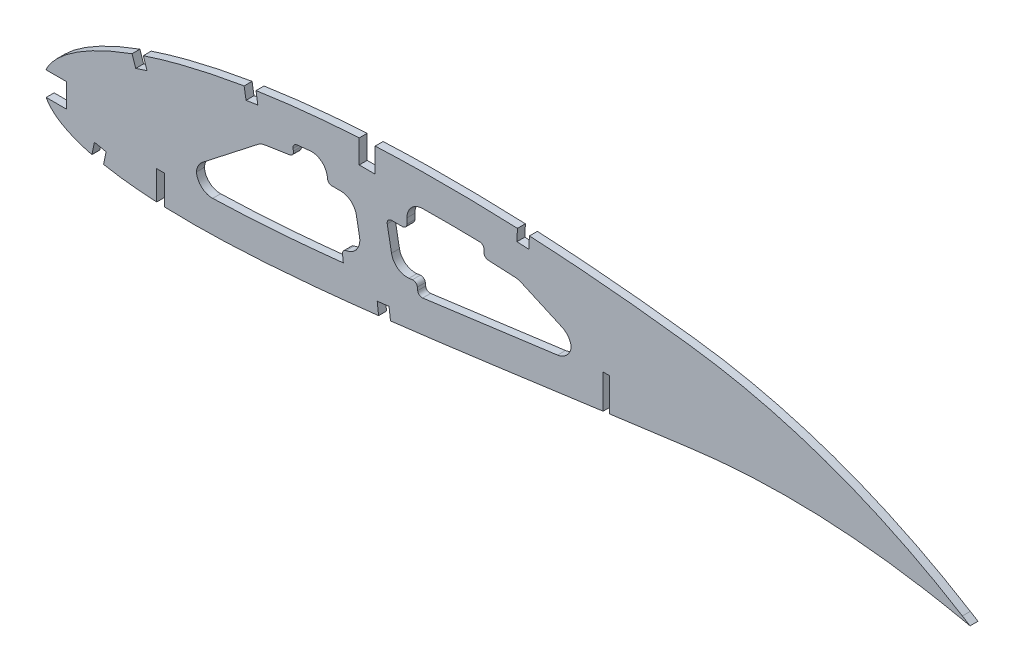
from build123d import *

# Parameters (mm, degrees)
BOSS_EXTRUDE1_DEPTH = 3.175
CUT_EXTRUDE1_DEPTH  = 7.62
SKETCH3_W           = 9.525
SKETCH3_H           = 9.525
CUT_EXTRUDE2_DEPTH  = 7.62
CUT_EXTRUDE3_DEPTH  = 7.62
FILLET1_R           = 6.35
FILLET2_R           = 1.778


with BuildPart() as part:
    # Sketch1 → Boss-Extrude1 (new body)
    with BuildSketch(Plane.XY):
        with BuildLine():
            Line((366.779221984, -0.572532859), (370.310025602, -1.32569148))
            Line((370.310025602, -1.32569148), (367.237248504, 0.572532859))
            add(Edge.make_bspline(
                [(367.237248504, 0.572532859), (367.209115751, 0.589912016), (367.096693954, 0.659361177), (366.843387397, 0.814735964), (366.421579402, 1.073520617), (365.831084917, 1.43391727), (365.072362673, 1.894969327), (364.145030833, 2.453448145), (363.049668235, 3.107539147), (361.78654025, 3.854149183), (360.355776171, 4.689782048), (358.757920825, 5.61105264), (356.993113179, 6.61274511), (355.06203687, 7.690766613), (352.96535437, 8.839989942), (350.703462511, 10.055224806), (348.277171256, 11.330289826), (345.687411743, 12.659700467), (342.934656313, 14.036115757), (340.020202795, 15.453807339), (336.945022097, 16.905706333), (333.710163942, 18.384066929), (330.317486658, 19.882862373), (326.767928213, 21.392774778), (323.06351151, 22.907262237), (319.205813659, 24.417705773), (315.197118609, 25.917225993), (311.038972972, 27.396108947), (306.73448515, 28.847891701), (302.285743308, 30.263143128), (297.695928748, 31.634176974), (292.967708233, 32.952104115), (288.10502333, 34.210165552), (283.11095799, 35.399199558), (277.989744959, 36.511247133), (272.745455003, 37.539613083), (267.382486443, 38.474030655), (261.915700498, 39.313771303), (256.433056518, 40.012293244), (250.961692668, 40.697383276), (245.498477017, 41.34096267), (239.968489428, 41.957278945), (234.377050063, 42.54286215), (228.729705217, 43.095881158), (223.032171983, 43.613949148), (217.290371144, 44.095546934), (211.509858724, 44.537945534), (205.696729956, 44.940463429), (199.8567319, 45.299561873), (193.996084852, 45.614971395), (188.120738144, 45.884492116), (182.236806039, 46.106266996), (176.350536437, 46.278957311), (170.468039484, 46.400908527), (164.595684421, 46.47135392), (158.739579431, 46.488368695), (152.90609078, 46.451648421), (147.101327081, 46.35993231), (141.331661108, 46.21196474), (135.603209819, 46.00746964), (129.92216764, 45.746535631), (124.294754737, 45.426977601), (118.727075839, 45.050831997), (113.22533102, 44.616518763), (107.79556513, 44.123922344), (102.443468619, 43.575096068), (97.175000212, 42.968547242), (91.995806101, 42.306001647), (86.911551284, 41.588758347), (81.927940427, 40.816426555), (77.050312099, 39.991237197), (72.283930644, 39.114034533), (67.633838897, 38.187390229), (63.105099551, 37.211546097), (58.702506527, 36.189429331), (54.430635268, 35.12282073), (50.29407794, 34.013672938), (46.297027813, 32.864647422), (42.443526778, 31.678350961), (38.73806709, 30.456087063), (35.183449271, 29.20248999), (31.784039791, 27.918449689), (28.542442713, 26.607921896), (25.46245696, 25.272695966), (22.546383362, 23.916842473), (19.79752229, 22.541904914), (17.217832841, 21.151735431), (14.809904809, 19.748465709), (12.576056134, 18.334702116), (10.517225629, 16.914030851), (8.636251908, 15.487343527), (6.933781057, 14.058245411), (5.410890546, 12.628912534), (4.069757076, 11.200329631), (2.910332492, 9.775012337), (1.93413617, 8.354089532), (1.141337537, 6.938905699), (0.533729736, 5.530488873), (0.110710257, 4.129631103), (-0.120847754, 2.738400014), (-0.178483964, 1.355680289), (-0.059405759, 0.451218221), (0, 0)],
                knots=[0, 0, 0, 0, 0.00025409, 0.001015374, 0.002283359, 0.004056577, 0.006330982, 0.009105274, 0.01237449, 0.016134024, 0.020379661, 0.025105976, 0.030306237, 0.035972206, 0.042099523, 0.048678064, 0.055701664, 0.063160184, 0.071045824, 0.079349827, 0.08806291, 0.097175757, 0.106678112, 0.116561573, 0.126814276, 0.1374283, 0.148393618, 0.15969976, 0.171338126, 0.183297699, 0.195569604, 0.208143556, 0.221011594, 0.234161831, 0.247587451, 0.261276823, 0.27522271, 0.289414144, 0.3037712, 0.317689227, 0.331784111, 0.346039677, 0.36044387, 0.374982721, 0.389640455, 0.404403317, 0.419256601, 0.43418675, 0.449177265, 0.464214782, 0.479284009, 0.49436974, 0.509457833, 0.524532346, 0.53957932, 0.554582984, 0.569529546, 0.584403417, 0.599190992, 0.613876838, 0.628447475, 0.642888675, 0.657186054, 0.671325546, 0.685294014, 0.699078148, 0.712665095, 0.726042645, 0.739197713, 0.752117587, 0.764792042, 0.777208152, 0.789355685, 0.80122396, 0.812803686, 0.824082909, 0.835054602, 0.845709571, 0.856037853, 0.866033835, 0.875688843, 0.884997719, 0.893953426, 0.902552897, 0.910789386, 0.918660734, 0.926166253, 0.933302626, 0.94007122, 0.94647478, 0.952517526, 0.958204819, 0.963546652, 0.9685566, 0.973249913, 0.977651041, 0.981787043, 0.985694226, 0.989415109, 0.993001157, 0.996508416, 1, 1, 1, 1], degree=3))
            add(Edge.make_bspline(
                [(0, 0), (0.094305225, -0.445183561), (0.283349084, -1.337596664), (0.796956591, -2.622301778), (1.476177967, -3.857275533), (2.335268581, -5.03923752), (3.368516216, -6.167864763), (4.573638936, -7.244331071), (5.949454767, -8.268057766), (7.494163107, -9.238578843), (9.205519965, -10.156924625), (11.08160183, -11.022524069), (13.120698043, -11.835106765), (15.320587008, -12.593586411), (17.678579271, -13.299118217), (20.19243298, -13.949982821), (22.859289626, -14.547089925), (25.676584203, -15.088915361), (28.641246729, -15.576009603), (31.750197347, -16.008099996), (35.00024492, -16.385456897), (38.388200927, -16.707288362), (41.910714326, -16.9742867), (45.564274184, -17.18662904), (49.34533406, -17.344988676), (53.250272092, -17.448763617), (57.275263844, -17.499571714), (61.416671846, -17.498175704), (65.670444823, -17.444202264), (70.032949035, -17.340633073), (74.49999818, -17.186812008), (79.067559409, -16.984600621), (83.731512725, -16.736033793), (88.487675073, -16.441954217), (93.331860865, -16.103665214), (98.259864016, -15.723879754), (103.267207887, -15.30354505), (108.349525408, -14.845111196), (113.502317177, -14.350873178), (118.721131264, -13.822395178), (124.001361141, -13.262163166), (129.338303799, -12.671992621), (134.727419145, -12.055032062), (140.163784234, -11.412397718), (145.642802026, -10.74775877), (151.159318159, -10.062385108), (156.708719705, -9.358916499), (162.286015513, -8.640665313), (167.885984275, -7.907549552), (173.503916032, -7.164792444), (179.134393031, -6.4117822), (184.772514322, -5.652391584), (190.413060751, -4.888980999), (196.050538376, -4.121785421), (201.679991678, -3.353984297), (207.296198332, -2.587685341), (212.893657193, -1.822958656), (218.467304002, -1.063605171), (224.011526297, -0.309532116), (229.521211727, 0.437731721), (234.99108049, 1.175955737), (240.415971972, 1.904208342), (245.79029012, 2.622028682), (251.108627927, 3.329686337), (256.286014622, 4.005702206), (261.308921574, 4.686074193), (266.194275064, 5.243828548), (271.018799677, 5.719891856), (275.78750695, 6.110198164), (280.494670713, 6.420362635), (285.134897569, 6.652601616), (289.702657326, 6.810157431), (294.192180199, 6.897704202), (298.597858723, 6.917463603), (302.913679308, 6.875737092), (307.134028762, 6.775888132), (311.253016964, 6.622398487), (315.264897433, 6.420446666), (319.163971775, 6.175537915), (322.944386272, 5.891284948), (326.600873145, 5.574323732), (330.127790902, 5.229294225), (333.519723856, 4.860138451), (336.771722702, 4.474591735), (339.878582354, 4.075192399), (342.835629531, 3.668504141), (345.638104292, 3.258648226), (348.281568103, 2.850857356), (350.76186785, 2.449021765), (353.074996968, 2.058474907), (355.217332046, 1.682865683), (357.185155535, 1.3258622), (358.975737519, 0.991968888), (360.585541683, 0.682844304), (362.012414965, 0.403582965), (363.253704214, 0.155417071), (364.307589717, -0.058157081), (365.172231074, -0.236296472), (365.846315097, -0.376076876), (366.328510303, -0.477721618), (366.618295084, -0.538205409), (366.747050131, -0.565670254), (366.779221984, -0.572532859)],
                knots=[0, 0, 0, 0, 0.003638255, 0.007293231, 0.011028136, 0.014901081, 0.018963272, 0.023258475, 0.027820626, 0.032679082, 0.03785316, 0.043361875, 0.049214679, 0.055422346, 0.061988786, 0.068918036, 0.076211157, 0.083868392, 0.091887411, 0.100265912, 0.108999867, 0.11808453, 0.127514843, 0.13728527, 0.147387918, 0.157816481, 0.168563473, 0.179619128, 0.190977373, 0.202626974, 0.214560478, 0.226767249, 0.239236417, 0.251959004, 0.264923895, 0.278119703, 0.291536035, 0.30516028, 0.318980685, 0.332985499, 0.347162791, 0.361498603, 0.375980747, 0.390597192, 0.405332594, 0.420174823, 0.435109533, 0.450124276, 0.465203068, 0.480333154, 0.495500583, 0.510689775, 0.525887335, 0.541078314, 0.556247233, 0.571381785, 0.586466041, 0.601484516, 0.616424329, 0.631269423, 0.646006524, 0.660620684, 0.675098187, 0.689422858, 0.703581825, 0.716907564, 0.730009274, 0.742952128, 0.755725558, 0.768319952, 0.780724338, 0.792926529, 0.804916041, 0.816679084, 0.828203524, 0.839474901, 0.850481359, 0.861207697, 0.871639326, 0.881763414, 0.891563605, 0.901027365, 0.910138977, 0.918883977, 0.927249278, 0.935221104, 0.942784739, 0.949928188, 0.956638465, 0.962904204, 0.968712288, 0.974054485, 0.978918432, 0.983297218, 0.987180246, 0.990560675, 0.993433358, 0.995790626, 0.997629588, 0.998945816, 0.999736593, 1, 1, 1, 1], degree=3))
        make_face()
    extrude(amount=BOSS_EXTRUDE1_DEPTH)

    # Sketch2 → Cut-Extrude1 (cut)
    with BuildSketch(Plane(origin=(0, 0, 0), x_dir=(-1, 0, 0), z_dir=(0, 0, -1))):
        Polygon((-226.175879032, 13.224515278), (-223.635879032, 13.224515278), (-223.635879032, 0.034213202), (-223.635879032, -0.783515638), (-226.175879032, -1.601244478), (-226.175879032, 0.034213202), align=None)
        Polygon((-48.375879032, -5.600977173), (-48.375879032, -17.01801887), (-48.375879032, -19.750567379), (-45.200879032, -18.044099627), (-45.200879032, -17.01801887), (-45.200879032, -5.600977173), align=None)
        Polygon((-132.513379032, 45.736898821), (-132.513379032, 36.143993965), (-126.163379032, 36.143993965), (-126.163379032, 45.736898821), (-126.163379032, 46.559990379), (-132.513379032, 48.500789295), align=None)
    extrude(amount=-CUT_EXTRUDE1_DEPTH, mode=Mode.SUBTRACT)

    # Sketch3 → Cut-Extrude2 (cut)
    with BuildSketch(Plane.XY.offset(3.175)):
        with Locations((4.348577792, 1.725398204)):
            Rectangle(SKETCH3_W, SKETCH3_H)
        Polygon((133.895690698, -12.137729329), (134.169531887, -14.470083726), (138.913436023, -13.913103041), (138.639594834, -11.580748644), (138.077073431, -6.844731778), (133.347815951, -7.40644956), align=None)
        Polygon((24.967200522, -9.876953877), (20.306964104, -8.907810929), (19.337454486, -13.571765616), (19.017747374, -14.92080263), (23.649458948, -16.018467939), (23.969166061, -14.669430925), align=None)
        with BuildLine():
            Line((41.321433418, 26.393922119), (39.810632112, 30.906701866))
            add(Edge.make_bspline(
                [(39.810632112, 30.906701866), (39.398873793, 30.769184142), (37.894597652, 30.261329765), (36.396552354, 29.735192442), (35.312007887, 29.342214059)],
                knots=[0, 0, 0, 0, 0.273427544, 1, 1, 1, 1], degree=3))
            Line((35.312007887, 29.342214059), (36.805350121, 24.881965345))
            Line((36.805350121, 24.881965345), (41.321433418, 26.393922119))
        make_face()
        with BuildLine():
            Line((85.624280504, 36.626114416), (84.90230804, 41.335327907))
            add(Edge.make_bspline(
                [(84.90230804, 41.335327907), (83.979718585, 41.193535561), (82.391504761, 40.943503096), (80.804941449, 40.683277808), (80.139800681, 40.572292745)],
                knots=[0, 0, 0, 0, 0.580571145, 1, 1, 1, 1], degree=3))
            Line((80.139800681, 40.572292745), (80.916790896, 35.904396126))
            Line((80.916790896, 35.904396126), (85.624280504, 36.626114416))
        make_face()
        with BuildLine():
            Line((193.941087695, 40.859287578), (194.183326577, 45.61464494))
            ThreePointArc((194.183326577, 45.61464494), (191.789299148, 45.732434347), (189.39491691, 45.842776438))
            Line((189.39491691, 45.842776438), (189.184743938, 41.09971448))
            Line((189.184743938, 41.09971448), (193.941087695, 40.859287578))
        make_face()
    extrude(amount=-CUT_EXTRUDE2_DEPTH, mode=Mode.SUBTRACT)

    # Sketch4 → Cut-Extrude3 (cut)
    with BuildSketch(Plane.XY.offset(3.175)):
        with BuildLine():
            Line((127.502433775, 4.688533857), (124.050451933, 23.443993965))
            Line((124.050451933, 23.443993965), (119.813379032, 23.443993965))
            Line((119.813379032, 23.443993965), (113.463379032, 23.443993965))
            Line((113.463379032, 23.443993965), (113.463379032, 31.879991554))
            add(Edge.make_bspline(
                [(113.463379032, 31.879991554), (112.290638403, 31.778475245), (109.945539571, 31.566326734), (106.432900771, 31.220298755), (102.924350774, 30.845585654), (100.588896046, 30.57621639), (99.421605686, 30.436454104)],
                knots=[0.248834567, 0.248834567, 0.248834567, 0.248834567, 0.377634488, 0.506434408, 0.635234328, 0.764034248, 0.764034248, 0.764034248, 0.764034248], degree=3))
            Line((99.421605686, 30.436454104), (100.102164394, 25.99737033))
            Line((100.102164394, 25.99737033), (86.87267557, 23.969120701))
            Line((86.87267557, 23.969120701), (61.075879032, 3.842208329))
            Line((61.075879032, 3.842208329), (61.075879032, -4.791866551))
            add(Edge.make_bspline(
                [(61.075879032, -4.791866551), (65.955994803, -4.764368164), (75.697637518, -4.495093596), (90.394506419, -3.633462019), (105.09635876, -2.428162799), (114.912631449, -1.453195109), (119.813474869, -0.934204982)],
                knots=[0.088296765, 0.088296765, 0.088296765, 0.088296765, 0.294057357, 0.499817949, 0.70557854, 0.911339132, 0.911339132, 0.911339132, 0.911339132], degree=3))
            Line((119.813474869, -0.934204982), (119.275523193, 3.711382161))
            Line((119.275523193, 3.711382161), (125.562712478, 4.458143367))
            Line((125.562712478, 4.458143367), (127.502433775, 4.688533857))
        make_face()
        with BuildLine():
            Line((149.190511343, 7.264536301), (149.749032187, 2.562201201))
            add(Edge.make_bspline(
                [(149.749032187, 2.562201201), (154.846835269, 3.201913662), (165.034248053, 4.515728791), (180.329199315, 6.558224181), (195.62747188, 8.63587756), (205.833665073, 10.031067282), (210.935879032, 10.727141289)],
                knots=[0.086693034, 0.086693034, 0.086693034, 0.086693034, 0.296227424, 0.505761815, 0.715296205, 0.924830596, 0.924830596, 0.924830596, 0.924830596], degree=3))
            Line((210.935879032, 10.727141289), (210.935879032, 18.871288601))
            Line((210.935879032, 18.871288601), (189.75201488, 28.35482471))
            Line((189.75201488, 28.35482471), (175.938475288, 29.053080913))
            Line((175.938475288, 29.053080913), (176.138710964, 33.571883724))
            add(Edge.make_bspline(
                [(176.138710964, 33.571883724), (173.560613823, 33.636883674), (168.402851468, 33.737321687), (160.669600144, 33.795620714), (152.937961553, 33.758580682), (147.788272062, 33.667462597), (145.213379032, 33.604473367)],
                knots=[0.147373022, 0.147373022, 0.147373022, 0.147373022, 0.325247969, 0.503122917, 0.680997865, 0.858872813, 0.858872813, 0.858872813, 0.858872813], degree=3))
            Line((145.213379032, 33.604473367), (145.213379032, 23.443993965))
            Line((145.213379032, 23.443993965), (136.963767817, 23.443993965))
            Line((136.963767817, 23.443993965), (140.139493462, 6.189501222))
            Line((140.139493462, 6.189501222), (149.190511343, 7.264536301))
        make_face()
    extrude(amount=-CUT_EXTRUDE3_DEPTH, mode=Mode.SUBTRACT)

    # Fillet1
    # the kernel refuses this fillet: 6.35 mm, written as the material it adds along each edge
    with BuildSketch(Plane(origin=(210.935879032, 10.727141289, 3.175), x_dir=(-0.9908129389380453, -0.13523949139564623, 0), z_dir=(0, 0, -1))) as fillet1_piece_1:
        with BuildLine():
            CenterArc((5.542145257, 6.349999996), FILLET1_R, 187.772468739, 82.2254658)
            Line((-0.749516905, 5.491229226), (-0.875350148, 5.47405381))
            Line((-0.875350148, 5.47405381), (-0.125833243, -0.017175415))
            Line((-0.125833243, -0.017175415), (8.427e-06, -0.127))
            ThreePointArc((8.427e-06, -0.127), (2.770957211, -0.126929064), (5.541911767, -0.127))
            Line((5.541911767, -0.127), (5.541916345, 0))
        make_face()
    fillet1_piece_1_solid = extrude(amount=3.175, mode=Mode.PRIVATE)
    with BuildSketch(Plane(origin=(210.935879032, 18.871288601, 3.175), x_dir=(0, -1, 0), z_dir=(0, 0, -1))) as fillet1_piece_2:
        with BuildLine():
            CenterArc((FILLET1_R * 0.647957175383, FILLET1_R), FILLET1_R, 204.116981242, 65.883018758)
            Line((-FILLET1_R * 0.264755941357, FILLET1_R * 0.591399013059), (-FILLET1_R * 0.283010203692, FILLET1_R * 0.58322699332))
            Line((-FILLET1_R * 0.283010203692, FILLET1_R * 0.58322699332), (-FILLET1_R * 0.0129591435077, -FILLET1_R * 0.02))
            Line((-FILLET1_R * 0.0129591435077, -FILLET1_R * 0.02), (FILLET1_R * 0.647957175383, -FILLET1_R * 0.02))
            Line((FILLET1_R * 0.647957175383, -FILLET1_R * 0.02), (FILLET1_R * 0.647957175383, 0))
        make_face()
    fillet1_piece_2_solid = extrude(amount=3.175, mode=Mode.PRIVATE)
    with BuildSketch(Plane(origin=(189.75201488, 28.35482471, 3.175), x_dir=(0.9127131167407931, -0.4086009869411811, 0), z_dir=(0, 0, -1))) as fillet1_piece_3:
        with BuildLine():
            CenterArc((FILLET1_R * 0.187354634324, FILLET1_R), FILLET1_R, 248.776781818, 21.223218182)
            Line((-FILLET1_R * 0.174647715097, FILLET1_R * 0.0678228178003), (-FILLET1_R * 0.181887762085, FILLET1_R * 0.0491792741563))
            Line((-FILLET1_R * 0.181887762085, FILLET1_R * 0.0491792741563), (-FILLET1_R * 0.00374709268649, -FILLET1_R * 0.02))
            Line((-FILLET1_R * 0.00374709268649, -FILLET1_R * 0.02), (FILLET1_R * 0.187354634324, -FILLET1_R * 0.02))
            Line((FILLET1_R * 0.187354634324, -FILLET1_R * 0.02), (FILLET1_R * 0.187354634324, 0))
        make_face()
    fillet1_piece_3_solid = extrude(amount=3.175, mode=Mode.PRIVATE)
    with BuildSketch(Plane(origin=(140.139493462, 6.189501222, 3.175), x_dir=(-0.18101173288940534, 0.9834809365495473, 0), z_dir=(0, 0, -1))) as fillet1_piece_4:
        with BuildLine():
            CenterArc((FILLET1_R * 0.938157713111, FILLET1_R), FILLET1_R, 183.655120797, 86.344879203)
            Line((-FILLET1_R * 0.0598081465259, FILLET1_R * 0.93624936864), (-FILLET1_R * 0.0797674637187, FILLET1_R * 0.934974356013))
            Line((-FILLET1_R * 0.0797674637187, FILLET1_R * 0.934974356013), (-FILLET1_R * 0.0187631542622, -FILLET1_R * 0.02))
            Line((-FILLET1_R * 0.0187631542622, -FILLET1_R * 0.02), (FILLET1_R * 0.938157713111, -FILLET1_R * 0.02))
            Line((FILLET1_R * 0.938157713111, -FILLET1_R * 0.02), (FILLET1_R * 0.938157713111, 0))
        make_face()
    fillet1_piece_4_solid = extrude(amount=3.175, mode=Mode.PRIVATE)
    with BuildSketch(Plane(origin=(145.213379032, 33.604473367, 3.175), x_dir=(0.9998187254385299, 0.01903985983334144, 0), z_dir=(0, 0, -1))) as fillet1_piece_5:
        with BuildLine():
            CenterArc((6.230228001, 6.349909176), FILLET1_R, 181.090969533, 89.215474752)
            Line((-0.118620905, 6.229006066), (-0.245597883, 6.226588004))
            Line((-0.245597883, 6.226588004), (-0.126976978, -0.002418062))
            Line((-0.126976978, -0.002418062), (-0.000687951, -0.126998137))
            ThreePointArc((-0.000687951, -0.126998137), (3.132097605, -0.135430111), (6.264869823, -0.126998184))
            Line((6.264869823, -0.126998184), (6.264190571, 0))
        make_face()
    fillet1_piece_5_solid = extrude(amount=3.175, mode=Mode.PRIVATE)
    with BuildSketch(Plane(origin=(113.463379032, 31.879991554, 3.175), x_dir=(0, -1, 0), z_dir=(0, 0, -1))) as fillet1_piece_6:
        with BuildLine():
            CenterArc((6.978060998, 6.35), FILLET1_R, 174.143248223, 95.856751777)
            Line((0.66120721, 6.997964681), (0.534870134, 7.010923975))
            ThreePointArc((0.534870134, 7.010923975), (0.190283078, 3.512235041), (-0.126526839, 0.010952582))
            Line((-0.126526839, 0.010952582), (0, -0.127))
            Line((0, -0.127), (6.978060998, -0.127))
            Line((6.978060998, -0.127), (6.978060998, 0))
        make_face()
    fillet1_piece_6_solid = extrude(amount=3.175, mode=Mode.PRIVATE)
    with BuildSketch(Plane(origin=(124.050451933, 23.443993965, 3.175), x_dir=(0.18101173288940445, -0.9834809365495474, 0), z_dir=(0, 0, -1))) as fillet1_piece_7:
        with BuildLine():
            CenterArc((FILLET1_R * 0.832744425107, FILLET1_R), FILLET1_R, 190.428695923, 79.571304077)
            Line((-FILLET1_R * 0.150736511443, FILLET1_R * 0.818988267111), (-FILLET1_R * 0.170406130174, FILLET1_R * 0.815368032453))
            Line((-FILLET1_R * 0.170406130174, FILLET1_R * 0.815368032453), (-FILLET1_R * 0.0166548885021, -FILLET1_R * 0.02))
            Line((-FILLET1_R * 0.0166548885021, -FILLET1_R * 0.02), (FILLET1_R * 0.832744425107, -FILLET1_R * 0.02))
            Line((FILLET1_R * 0.832744425107, -FILLET1_R * 0.02), (FILLET1_R * 0.832744425107, 0))
        make_face()
    fillet1_piece_7_solid = extrude(amount=3.175, mode=Mode.PRIVATE)
    with BuildSketch(Plane(origin=(127.502433775, 4.688533857, 3.175), x_dir=(-0.1810117328894044, 0.9834809365495475, 0), z_dir=(0, 0, -1))) as fillet1_piece_8:
        with BuildLine():
            CenterArc((FILLET1_R * 1.06591885994, -FILLET1_R), FILLET1_R, 90, 93.655120797)
            Line((FILLET1_R * 0.0679530002993, -FILLET1_R * 1.06375063136), (FILLET1_R * 0.0479936831066, -FILLET1_R * 1.06502564399))
            Line((FILLET1_R * 0.0479936831066, -FILLET1_R * 1.06502564399), (-FILLET1_R * 0.0213183771987, FILLET1_R * 0.02))
            Line((-FILLET1_R * 0.0213183771987, FILLET1_R * 0.02), (FILLET1_R * 1.06591885994, FILLET1_R * 0.02))
            Line((FILLET1_R * 1.06591885994, FILLET1_R * 0.02), (FILLET1_R * 1.06591885994, 0))
        make_face()
    fillet1_piece_8_solid = extrude(amount=3.175, mode=Mode.PRIVATE)
    with BuildSketch(Plane(origin=(86.87267557, 23.969120701, 3.175), x_dir=(0.9884507988139054, 0.15154213382473017, 0), z_dir=(0, 0, -1))) as fillet1_piece_9:
        with BuildLine():
            CenterArc((FILLET1_R * 0.260903569055, FILLET1_R), FILLET1_R, 240.754603776, 29.245396224)
            Line((-FILLET1_R * 0.227647564892, FILLET1_R * 0.127464734513), (-FILLET1_R * 0.237418587571, FILLET1_R * 0.110014029203))
            Line((-FILLET1_R * 0.237418587571, FILLET1_R * 0.110014029203), (-FILLET1_R * 0.0052180713811, -FILLET1_R * 0.02))
            Line((-FILLET1_R * 0.0052180713811, -FILLET1_R * 0.02), (FILLET1_R * 0.260903569055, -FILLET1_R * 0.02))
            Line((FILLET1_R * 0.260903569055, -FILLET1_R * 0.02), (FILLET1_R * 0.260903569055, 0))
        make_face()
    fillet1_piece_9_solid = extrude(amount=3.175, mode=Mode.PRIVATE)
    with BuildSketch(Plane(origin=(61.075879032, 3.842208329, 3.175), x_dir=(0.7884220988432111, 0.6151346145809596, 0), z_dir=(0, 0, -1))) as fillet1_piece_10:
        with BuildLine():
            CenterArc((FILLET1_R * 0.488146369798, FILLET1_R), FILLET1_R, 217.961702275, 52.038297725)
            Line((-FILLET1_R * 0.300275729045, FILLET1_R * 0.384865385419), (-FILLET1_R * 0.316044171022, FILLET1_R * 0.372562693127))
            Line((-FILLET1_R * 0.316044171022, FILLET1_R * 0.372562693127), (-FILLET1_R * 0.00976292739597, -FILLET1_R * 0.02))
            Line((-FILLET1_R * 0.00976292739597, -FILLET1_R * 0.02), (FILLET1_R * 0.488146369798, -FILLET1_R * 0.02))
            Line((FILLET1_R * 0.488146369798, -FILLET1_R * 0.02), (FILLET1_R * 0.488146369798, 0))
        make_face()
    fillet1_piece_10_solid = extrude(amount=3.175, mode=Mode.PRIVATE)
    with BuildSketch(Plane(origin=(61.075879032, -4.791866551, 3.175), x_dir=(0, 1, 0), z_dir=(0, 0, -1))) as fillet1_piece_11:
        with BuildLine():
            CenterArc((6.445593567, 6.35), FILLET1_R, 178.630054344, 91.369945656)
            Line((0.0974086, 6.501814429), (-0.0295551, 6.504850718))
            ThreePointArc((-0.0295551, 6.504850718), (-0.093136915, 3.253047023), (-0.126997984, 0.000715606))
            Line((-0.126997984, 0.000715606), (0, -0.127))
            Line((0, -0.127), (6.445593567, -0.127))
            Line((6.445593567, -0.127), (6.445593567, 0))
        make_face()
    fillet1_piece_11_solid = extrude(amount=3.175, mode=Mode.PRIVATE)
    add([fillet1_piece_1_solid, fillet1_piece_2_solid, fillet1_piece_3_solid, fillet1_piece_4_solid, fillet1_piece_5_solid, fillet1_piece_6_solid, fillet1_piece_7_solid, fillet1_piece_8_solid, fillet1_piece_9_solid, fillet1_piece_10_solid, fillet1_piece_11_solid])

    # Fillet2
    fillet2_edges = [part.edges().sort_by_distance(p)[0] for p in [
        (175.938475288, 29.053080913, 1.5875),
        (176.138710964, 33.571883724, 1.5875),
        (145.213379032, 23.443993965, 1.5875),
        (136.963767817, 23.443993965, 1.5875),
        (149.749032187, 2.562201201, 1.5875),
        (149.190511343, 7.264536301, 1.5875),
        (119.275523193, 3.711382161, 1.5875),
        (113.463379032, 23.443993965, 1.5875),
        (99.421605686, 30.436454104, 1.5875),
        (100.102164394, 25.99737033, 1.5875),
    ]]
    fillet(fillet2_edges, radius=FILLET2_R)


solid = part.part
